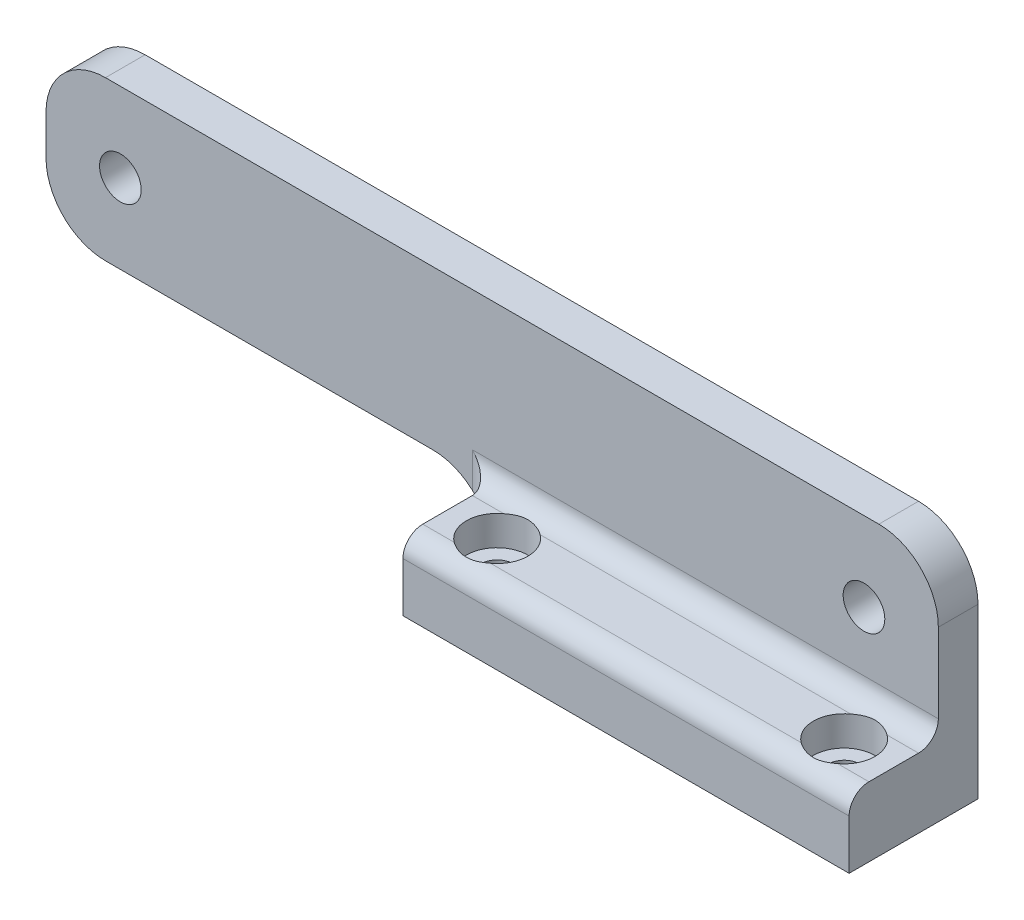
from build123d import *

# Parameters (mm, degrees)
ESBO_O1_W                  = 90
ESBO_O1_H                  = 16
ESBO_O1_R                  = 2.1
RESSALTO_EXTRUS_O1_DEPTH   = 4
ESBO_O2_W                  = 45
ESBO_O2_H                  = 13
ESBO_O2_R                  = 1.6
RESSALTO_EXTRUS_O3_DEPTH   = 7
FILETE1_R                  = 6
FILETE2_R                  = 2
CORTE_EXTRUS_O1_DEPTH      = 10
CORTE_EXTRUS_O1_DEPTH_BACK = 3
ESBO_O3_R                  = 3.1
FILETE3_R                  = 2


with BuildPart() as part:
    # Esboço1 → Ressalto-extrusão1 (new body)
    with BuildSketch(Plane.XY):
        Rectangle(ESBO_O1_W, ESBO_O1_H)
        with Locations((-37.5, 0)):
            Circle(ESBO_O1_R, mode=Mode.SUBTRACT)
        with Locations((37.5, 0)):
            Circle(ESBO_O1_R, mode=Mode.SUBTRACT)
    extrude(amount=RESSALTO_EXTRUS_O1_DEPTH)

    # Esboço2 → Ressalto-extrusão3 (add)
    with BuildSketch(Plane.XZ.offset(8)):
        with Locations((22.5, 6.5)):
            Rectangle(ESBO_O2_W, ESBO_O2_H)
        with Locations((40, 8.5)):
            Circle(ESBO_O2_R, mode=Mode.SUBTRACT)
        with Locations((5, 8.5)):
            Circle(ESBO_O2_R, mode=Mode.SUBTRACT)
    extrude(amount=RESSALTO_EXTRUS_O3_DEPTH)

    # Filete1
    filete1_edges = [part.edges().sort_by_distance(p)[0] for p in [
        (0, -8, 2),
        (-45, 8, 2),
        (45, 8, 2),
        (-45, -8, 2),
    ]]
    fillet(filete1_edges, radius=FILETE1_R)

    # Filete2
    filete2_edges = [part.edges().sort_by_distance(p)[0] for p in [
        (22.5, -8, 4),
        (0, -11, 4),
    ]]
    fillet(filete2_edges, radius=FILETE2_R)

    # Esboço3 → Corte-extrusão1 (cut, two sides: drawn at the far end of the back side and taken through both)
    with BuildSketch(Plane(origin=(0, -8, 0), x_dir=(1, 0, 0), z_dir=(0, 1, 0)).offset(-CORTE_EXTRUS_O1_DEPTH_BACK)):
        with Locations(Location((5, -8.5, 0), (0, 0, 53.750679117))):
            Circle(ESBO_O3_R)
        with Locations(Location((40, -8.5, 0), (0, 0, 53.750679117))):
            Circle(ESBO_O3_R)
    extrude(amount=CORTE_EXTRUS_O1_DEPTH + CORTE_EXTRUS_O1_DEPTH_BACK, mode=Mode.SUBTRACT)

    # Filete3
    # the kernel refuses this fillet: 2 mm, written as the material it takes off along each edge
    with BuildSketch(Plane(origin=(50, -8, 13), x_dir=(0, 0, -1), z_dir=(-1, 0, 0))) as filete3_piece_1:
        with BuildLine():
            CenterArc((FILETE3_R, FILETE3_R), FILETE3_R, 180, 90)
            Line((0, FILETE3_R), (0, 0))
            Line((0, 0), (FILETE3_R, 0))
        make_face()
    extrude(amount=55, mode=Mode.SUBTRACT)


solid = part.part
